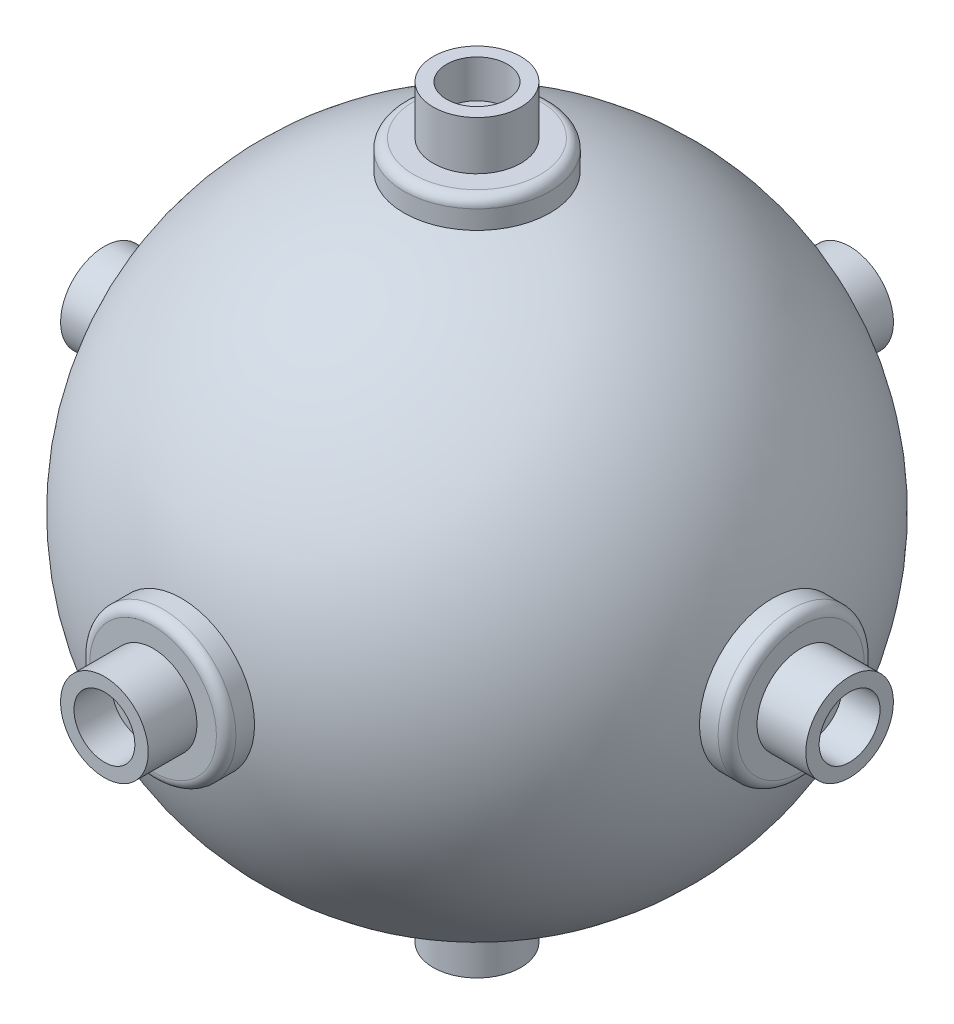
from build123d import *

# Parameters (mm, degrees)
SKETCH6_R           = 3.81
BOSS_EXTRUDE1_DEPTH = 1.016
SKETCH9_R           = 2.286
BOSS_EXTRUDE3_DEPTH = 2.54
CIRPATTERN1_COUNT   = 4
SKETCH10_R          = 3.81
BOSS_EXTRUDE4_DEPTH = 1.016
SKETCH11_R          = 2.286
BOSS_EXTRUDE5_DEPTH = 2.54
CIRPATTERN2_COUNT   = 4
FILLET1_R           = 0.508


with BuildPart() as part:
    # Sketch1 → Revolve1 (revolve)
    with BuildSketch(Plane.XY):
        with BuildLine():
            Line((0, -15.875), (0, 15.875))
            ThreePointArc((0, 15.875), (-15.875, 0), (0, -15.875))
        make_face()
    revolve(axis=Axis((0, 15.875, 0), (0, -1, 0)))

    # Sketch6 → Boss-Extrude1 (add, symmetric)
    with BuildSketch(Plane.XY.offset(15.875)):
        Circle(SKETCH6_R)
    boss_extrude1 = extrude(amount=BOSS_EXTRUDE1_DEPTH, both=True)

    # Sketch9 → Boss-Extrude3 (add)
    with BuildSketch(Plane.XY.offset(16.891)):
        Circle(SKETCH9_R)
    boss_extrude3 = extrude(amount=BOSS_EXTRUDE3_DEPTH)

    # CirPattern1: Boss-Extrude1, Boss-Extrude3 ×4 about axis
    cirpattern1_axis = Axis((0, 15.875, 0), (0, -1, 0))
    add([boss_extrude1.rotate(cirpattern1_axis, i * 360 / CIRPATTERN1_COUNT) for i in range(1, CIRPATTERN1_COUNT)])
    add([boss_extrude3.rotate(cirpattern1_axis, i * 360 / CIRPATTERN1_COUNT) for i in range(1, CIRPATTERN1_COUNT)])

    # Sketch10 → Boss-Extrude4 (add, symmetric)
    with BuildSketch(Plane(origin=(0, 15.875, 0), x_dir=(1, 0, 0), z_dir=(0, 1, 0))):
        Circle(SKETCH10_R)
    boss_extrude4 = extrude(amount=BOSS_EXTRUDE4_DEPTH, both=True)

    # Sketch11 → Boss-Extrude5 (add)
    with BuildSketch(Plane(origin=(0, 16.891, 0), x_dir=(1, 0, 0), z_dir=(0, 1, 0))):
        Circle(SKETCH11_R)
    boss_extrude5 = extrude(amount=BOSS_EXTRUDE5_DEPTH)

    # Mirror1: Boss-Extrude4, Boss-Extrude5 across plane
    add(boss_extrude4.mirror(Plane.ZX))
    add(boss_extrude5.mirror(Plane.ZX))

    # Sketch13 → CBORE for _00 Binding Head Machine Screw (revolve, cut)
    with BuildSketch(Plane(origin=(0, 19.431, 0), x_dir=(0, 0, 1), z_dir=(1, 0, 0))):
        Polygon((0, 0), (0, 4.229701142), (0.6985, 3.81), (0.6985, 1.9812), (1.5875, 1.9812), (1.5875, 0), align=None)
    cbore_for_00_binding_head_machine_screw = revolve(axis=Axis((0, 25.781, 0), (0, -1, 0)), mode=Mode.SUBTRACT)

    # CirPattern2: CBORE for _00 Binding Head Machine Screw ×4 about axis
    cirpattern2_axis = Axis((-15.875, 0, 0), (1, 0, 0))
    for i in range(1, CIRPATTERN2_COUNT):
        add(cbore_for_00_binding_head_machine_screw.rotate(cirpattern2_axis, i * 360 / CIRPATTERN2_COUNT), mode=Mode.SUBTRACT)

    # Sketch19 → CBORE for _00 Binding Head Machine S 2 (revolve, cut)
    with BuildSketch(Plane(origin=(19.431, 0, 0), x_dir=(0, 0, -1), z_dir=(0, 1, 0))):
        Polygon((0, 0), (0, 4.229701142), (0.6985, 3.81), (0.6985, 1.9812), (1.5875, 1.9812), (1.5875, 0), align=None)
    cbore_for_00_binding_head_machine_s_2 = revolve(axis=Axis((25.781, 0, 0), (-1, 0, 0)), mode=Mode.SUBTRACT)

    # Mirror2: CBORE for _00 Binding Head Machine S 2 across plane
    add(cbore_for_00_binding_head_machine_s_2.mirror(Plane(origin=(0, 0, 0), x_dir=(0, 0, 1), z_dir=(1, 0, 0))), mode=Mode.SUBTRACT)

    # Fillet1
    fillet1_edges = [part.edges().sort_by_distance(p)[0] for p in [
        (3.81, 0, -16.891),
        (-3.81, -16.891, 0),
        (-16.891, 0, -3.81),
        (16.891, 0, 3.81),
        (-3.81, 0, 16.891),
        (-3.81, 16.891, 0),
    ]]
    fillet(fillet1_edges, radius=FILLET1_R)


solid = part.part
